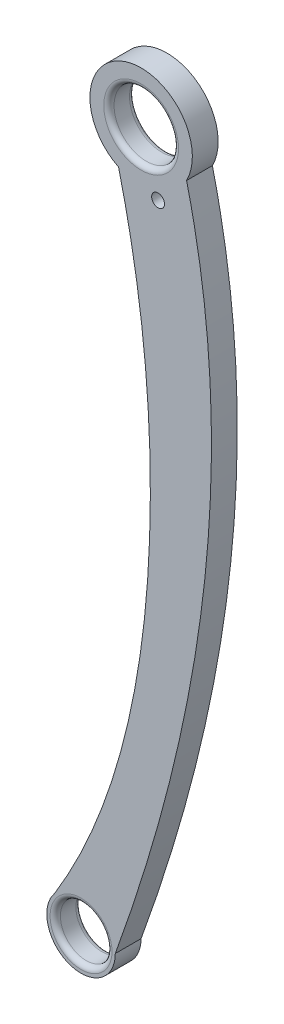
from build123d import *

# Parameters (mm, degrees)
SKETCH1_R           = 4
SKETCH1_R_2         = 1
SKETCH1_R_3         = 5
BOSS_EXTRUDE1_DEPTH = 2
FILLET1_R           = 0.8


with BuildPart() as part:
    # Sketch1 → Boss-Extrude1 (new, symmetric)
    with BuildSketch(Plane.XY):
        with BuildLine():
            ThreePointArc((-4.09240869, 3.386100226), (-1.799457661, -4.997542972), (5.311636624, 0))
            add(Edge.make_bspline(
                [(5.311636624, 0), (17.769363539, 34.421881869), (25.192042954, 73.13636609), (16.37011227, 109.364122199)],
                knots=[0, 0, 0, 0, 0.956773453, 0.956773453, 0.956773453, 0.956773453], degree=3))
            ThreePointArc((16.37011227, 109.364122199), (6.842083231, 120.574345754), (5.817157068, 105.897766593))
            add(Edge.make_bspline(
                [(-4.09240869, 3.386100226), (6.994812741, 21.577875377), (13.208144478, 57.701592599), (9.143863643, 92.456079954), (5.817157068, 105.897766593)],
                knots=[0, 0, 0, 0, 0.587614162, 0.97029995, 0.97029995, 0.97029995, 0.97029995], degree=3))
        make_face()
        Circle(SKETCH1_R, mode=Mode.SUBTRACT)
        with Locations((11.949864601, 104.478258332)):
            Circle(SKETCH1_R_2, mode=Mode.SUBTRACT)
        with Locations((9.321130613, 113.027146637)):
            Circle(SKETCH1_R_3, mode=Mode.SUBTRACT)
    extrude(amount=BOSS_EXTRUDE1_DEPTH, both=True)

    # Fillet1
    fillet1_edges = [part.edges().sort_by_distance(p)[0] for p in [
        (-4, 0, -2),
        (-4, 0, 2),
        (4.321130613, 113.027146637, -2),
        (4.321130613, 113.027146637, 2),
    ]]
    fillet(fillet1_edges, radius=FILLET1_R)


solid = part.part
